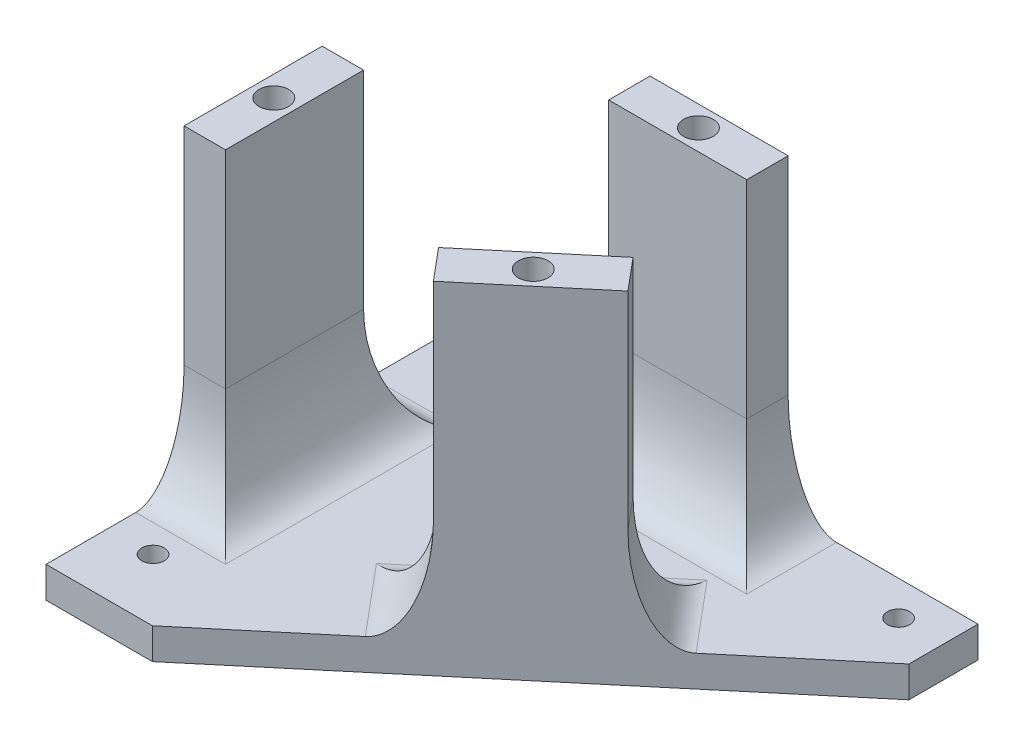
from build123d import *

# Parameters (mm, degrees)
SKETCH1_R           = 1.625
BOSS_EXTRUDE1_DEPTH = 4.5
SKETCH2_W           = 20
SKETCH2_H           = 6
SKETCH2_W_2         = 6
SKETCH2_H_2         = 20
BOSS_EXTRUDE2_DEPTH = 45
SKETCH3_R           = 2.15
CUT_EXTRUDE1_DEPTH  = 5
FILLET1_SIZE        = 7
FILLET1_SIZE_2      = 15


with BuildPart() as part:
    # Sketch1 → Boss-Extrude1 (new body)
    with BuildSketch(Plane(origin=(0, 0, 0), x_dir=(1, 0, 0), z_dir=(0, 1, 0))):
        Polygon((15.41232037, 0), (0, 0), (0, 60), (75, 60), (75, 50), align=None)
        with Locations(Location((68.5, 55, 0), (0, 0, 270))):
            Circle(SKETCH1_R, mode=Mode.SUBTRACT)
        with Locations(Location((6.5, 55, 0), (0, 0, 90))):
            Circle(SKETCH1_R, mode=Mode.SUBTRACT)
        with Locations(Location((6.5, 9, 0), (0, 0, 270))):
            Circle(SKETCH1_R, mode=Mode.SUBTRACT)
    extrude(amount=BOSS_EXTRUDE1_DEPTH)

    # Sketch2 → Boss-Extrude2 (add)
    with BuildSketch(Plane(origin=(0, 4.5, 0), x_dir=(1, 0, 0), z_dir=(0, 1, 0))):
        with Locations((37.5, 57)):
            Rectangle(SKETCH2_W, SKETCH2_H)
        with Locations((3, 30)):
            Rectangle(SKETCH2_W_2, SKETCH2_H_2)
        Polygon((52.866604616, 31.427876097), (37.545715754, 18.572123903), (33.688990096, 23.168390562), (49.009878958, 36.024142756), align=None)
    extrude(amount=BOSS_EXTRUDE2_DEPTH)

    # Sketch3 → Cut-Extrude1 (cut)
    with BuildSketch(Plane(origin=(0, 49.5, 0), x_dir=(1, 0, 0), z_dir=(0, 1, 0))):
        with Locations(Location((3, 30, 0), (0, 0, 270))):
            Circle(SKETCH3_R)
        with Locations(Location((37.5, 57, 0), (0, 0, 270))):
            Circle(SKETCH3_R)
        with Locations(Location((43.277797356, 27.298133329, 0), (0, 0, 270))):
            Circle(SKETCH3_R)
    extrude(amount=-CUT_EXTRUDE1_DEPTH, mode=Mode.SUBTRACT)

    # Fillet1
    # an asymmetric fillet: 15, 7 mm, written as the material it adds along each edge
    with BuildSketch(Plane(origin=(49.009878958, 4.5, -36.024142756), x_dir=(0.7660444431189766, 0, -0.642787609686541), z_dir=(0.6427876096865411, 0, 0.7660444431189767)), Plane(origin=(0, 4.5, -40), x_dir=(0, 0, -1), z_dir=(1, 0, 0)), Plane(origin=(37.545715754, 4.5, -18.572123903), x_dir=(-0.7660444431189747, 0, 0.6427876096865432), z_dir=(-0.6427876096865432, 0, -0.7660444431189748)), Plane(origin=(6, 4.5, -20), x_dir=(0, 0, 1), z_dir=(-1, 0, 0))) as fillet1_piece_1:
        with BuildLine():
            Bezier((FILLET1_SIZE, 0), (0, 0), (0, FILLET1_SIZE_2), weights=[1, 0.707106781, 1])
            Line((0, FILLET1_SIZE_2), (0, 0))
            Line((0, 0), (FILLET1_SIZE, 0))
        make_face()
    extrude(amount=6)
    with BuildSketch(Plane(origin=(27.5, 4.5, -60), x_dir=(-1, 0, 0), z_dir=(0, 0, 1)), Plane(origin=(47.5, 4.5, -54), x_dir=(1, 0, 0), z_dir=(0, 0, -1))) as fillet1_piece_2:
        with BuildLine():
            Bezier((FILLET1_SIZE, 0), (0, 0), (0, -FILLET1_SIZE_2), weights=[1, 0.707106781, 1])
            Line((0, -FILLET1_SIZE_2), (0, 0))
            Line((0, 0), (FILLET1_SIZE, 0))
        make_face()
    extrude(amount=6)
    with BuildSketch(Plane(origin=(33.688990096, 4.5, -23.168390562), x_dir=(-0.6427876096865404, 0, -0.7660444431189772), z_dir=(0.7660444431189771, 0, -0.6427876096865404)), Plane(origin=(6, 4.5, -40), x_dir=(1, 0, 0), z_dir=(0, 0, 1))) as fillet1_piece_3:
        with BuildLine():
            Bezier((FILLET1_SIZE, 0), (0, 0), (0, FILLET1_SIZE_2), weights=[1, 0.707106781, 1])
            Line((0, FILLET1_SIZE_2), (0, 0))
            Line((0, 0), (FILLET1_SIZE, 0))
        make_face()
    extrude(amount=20)
    with BuildSketch(Plane(origin=(27.5, 4.5, -54), x_dir=(0, 0, 1), z_dir=(1, 0, 0))) as fillet1_piece_4:
        with BuildLine():
            Bezier((FILLET1_SIZE, 0), (0, 0), (0, -FILLET1_SIZE_2), weights=[1, 0.707106781, 1])
            Line((0, -FILLET1_SIZE_2), (0, 0))
            Line((0, 0), (FILLET1_SIZE, 0))
        make_face()
    extrude(amount=20)
    with BuildSketch(Plane(origin=(33.688990096, 4.5, -23.168390562), x_dir=(-0.6427876096865404, 0, -0.7660444431189772), z_dir=(0.7660444431189771, 0, -0.6427876096865404))) as fillet1_piece_5a_section:
        with BuildLine():
            Bezier((FILLET1_SIZE, 0), (0, 0), (0, FILLET1_SIZE_2), weights=[1, 0.707106781, 1])
            Line((0, FILLET1_SIZE_2), (0, 0))
            Line((0, 0), (FILLET1_SIZE, 0))
        make_face()
    fillet1_piece_5a = extrude(amount=57.5, mode=Mode.PRIVATE)
    fillet1_piece_5a = split(fillet1_piece_5a, bisect_by=Plane(origin=(75, 8.294639166, -47.759587759), z_dir=(-1, 0, 0)), keep=Keep.TOP, mode=Mode.PRIVATE)
    fillet1_piece_5a = split(fillet1_piece_5a, bisect_by=Plane(origin=(60.829752449, 8.294639166, -60), z_dir=(0, 0, 1)), keep=Keep.TOP, mode=Mode.PRIVATE)
    fillet1_piece_5a = fillet1_piece_5a - Plane(origin=(68.5, 8.294639166, -55), x_dir=(0, 0, 1), z_dir=(0, -1, 0)) * Cylinder(1.625, 175, mode=Mode.PRIVATE)
    fillet1_piece_5a = split(fillet1_piece_5a, bisect_by=Plane(origin=(48.114987345, 8.294639166, -37.09063305), z_dir=(0.7660444431189766, 0, -0.642787609686541)), keep=Keep.TOP, mode=Mode.PRIVATE)
    with BuildSketch(Plane(origin=(24.905343595, 4.5, -64.750809373), x_dir=(0.7660444431189766, 0, -0.6427876096865409), z_dir=(0.6427876096865411, 0, 0.7660444431189767))) as fillet1_piece_5b_section:
        with BuildLine():
            Bezier((FILLET1_SIZE, 0), (0, 0), (0, FILLET1_SIZE_2), weights=[1, 0.707106781, 1])
            Line((0, FILLET1_SIZE_2), (0, 0))
            Line((0, 0), (FILLET1_SIZE, 0))
        make_face()
    fillet1_piece_5b = extrude(amount=43.5, mode=Mode.PRIVATE)
    fillet1_piece_5b = split(fillet1_piece_5b, bisect_by=Plane(origin=(50.108066505, 8.227156202, -36.945631521), z_dir=(-0.6427876096865404, 0, -0.7660444431189771)), keep=Keep.TOP, mode=Mode.PRIVATE)
    fillet1_piece_5 = fillet1_piece_5a & fillet1_piece_5b
    add(fillet1_piece_5)
    with BuildSketch(Plane(origin=(0, 4.5, -40), x_dir=(0, 0, -1), z_dir=(1, 0, 0))) as fillet1_piece_6a_section:
        with BuildLine():
            Bezier((FILLET1_SIZE, 0), (0, 0), (0, FILLET1_SIZE_2), weights=[1, 0.707106781, 1])
            Line((0, FILLET1_SIZE_2), (0, 0))
            Line((0, 0), (FILLET1_SIZE, 0))
        make_face()
    fillet1_piece_6a = extrude(amount=43.5, mode=Mode.PRIVATE)
    fillet1_piece_6a = split(fillet1_piece_6a, bisect_by=Plane(origin=(6, 8.227154746, -41.433583062), z_dir=(1, 0, 0)), keep=Keep.TOP, mode=Mode.PRIVATE)
    with BuildSketch(Plane(origin=(6, 4.5, -77.5), x_dir=(1, 0, 0), z_dir=(0, 0, 1))) as fillet1_piece_6b_section:
        with BuildLine():
            Bezier((FILLET1_SIZE, 0), (0, 0), (0, FILLET1_SIZE_2), weights=[1, 0.707106781, 1])
            Line((0, FILLET1_SIZE_2), (0, 0))
            Line((0, 0), (FILLET1_SIZE, 0))
        make_face()
    fillet1_piece_6b = extrude(amount=57.5, mode=Mode.PRIVATE)
    fillet1_piece_6b = split(fillet1_piece_6b, bisect_by=Plane(origin=(7.535537535, 8.087590717, -60), z_dir=(0, 0, 1)), keep=Keep.TOP, mode=Mode.PRIVATE)
    fillet1_piece_6b = fillet1_piece_6b - Plane(origin=(6.5, 8.087590717, -55), x_dir=(0, 0, -1), z_dir=(0, -1, 0)) * Cylinder(1.625, 175, mode=Mode.PRIVATE)
    fillet1_piece_6b = split(fillet1_piece_6b, bisect_by=Plane(origin=(7.535537535, 8.087590717, -40), z_dir=(0, 0, -1)), keep=Keep.TOP, mode=Mode.PRIVATE)
    fillet1_piece_6 = fillet1_piece_6a & fillet1_piece_6b
    add(fillet1_piece_6)
    with BuildSketch(Plane(origin=(37.545715754, 4.5, -18.572123903), x_dir=(-0.7660444431189747, 0, 0.6427876096865432), z_dir=(-0.6427876096865432, 0, -0.7660444431189748))) as fillet1_piece_7a_section:
        with BuildLine():
            Bezier((FILLET1_SIZE, 0), (0, 0), (0, FILLET1_SIZE_2), weights=[1, 0.707106781, 1])
            Line((0, FILLET1_SIZE_2), (0, 0))
            Line((0, 0), (FILLET1_SIZE, 0))
        make_face()
    fillet1_piece_7a = extrude(amount=43.5, mode=Mode.PRIVATE)
    fillet1_piece_7a = split(fillet1_piece_7a, bisect_by=Plane(origin=(32.590801758, 8.227154758, -22.246901132), z_dir=(-0.6427876096865404, 0, -0.7660444431189771)), keep=Keep.TOP, mode=Mode.PRIVATE)
    with BuildSketch(Plane(origin=(4.962323479, 4.5, 0.936144801), x_dir=(-0.6427876096865404, 0, -0.7660444431189771), z_dir=(0.7660444431189771, 0, -0.6427876096865404))) as fillet1_piece_7b_section:
        with BuildLine():
            Bezier((FILLET1_SIZE, 0), (0, 0), (0, FILLET1_SIZE_2), weights=[1, 0.707106781, 1])
            Line((0, FILLET1_SIZE_2), (0, 0))
            Line((0, 0), (FILLET1_SIZE, 0))
        make_face()
    fillet1_piece_7b = extrude(amount=57.5, mode=Mode.PRIVATE)
    fillet1_piece_7b = split(fillet1_piece_7b, bisect_by=Plane(origin=(18.636133347, 8.197576352, 0), z_dir=(0, 0, -1)), keep=Keep.TOP, mode=Mode.PRIVATE)
    fillet1_piece_7b = fillet1_piece_7b - Plane(origin=(6.5, 8.197576352, -9), x_dir=(0, 0, 1), z_dir=(0, -1, 0)) * Cylinder(1.625, 175, mode=Mode.PRIVATE)
    fillet1_piece_7b = split(fillet1_piece_7b, bisect_by=Plane(origin=(32.760947063, 8.197576352, -24.27438918), z_dir=(-0.7660444431189748, 0, 0.6427876096865432)), keep=Keep.TOP, mode=Mode.PRIVATE)
    fillet1_piece_7 = fillet1_piece_7a & fillet1_piece_7b
    add(fillet1_piece_7)
    with BuildSketch(Plane(origin=(6, 4.5, -40), x_dir=(1, 0, 0), z_dir=(0, 0, 1))) as fillet1_piece_8a_section:
        with BuildLine():
            Bezier((FILLET1_SIZE, 0), (0, 0), (0, FILLET1_SIZE_2), weights=[1, 0.707106781, 1])
            Line((0, FILLET1_SIZE_2), (0, 0))
            Line((0, 0), (FILLET1_SIZE, 0))
        make_face()
    fillet1_piece_8a = extrude(amount=57.5, mode=Mode.PRIVATE)
    fillet1_piece_8a = split(fillet1_piece_8a, bisect_by=Plane(origin=(7.977246716, 8.859328902, 0), z_dir=(0, 0, -1)), keep=Keep.TOP, mode=Mode.PRIVATE)
    fillet1_piece_8a = fillet1_piece_8a - Plane(origin=(6.5, 8.859328902, -9), x_dir=(0, 0, 1), z_dir=(0, -1, 0)) * Cylinder(1.625, 175, mode=Mode.PRIVATE)
    fillet1_piece_8a = split(fillet1_piece_8a, bisect_by=Plane(origin=(7.977246716, 8.859328902, -20), z_dir=(0, 0, 1)), keep=Keep.TOP, mode=Mode.PRIVATE)
    with BuildSketch(Plane(origin=(43.5, 4.5, -20), x_dir=(0, 0, 1), z_dir=(-1, 0, 0))) as fillet1_piece_8b_section:
        with BuildLine():
            Bezier((FILLET1_SIZE, 0), (0, 0), (0, FILLET1_SIZE_2), weights=[1, 0.707106781, 1])
            Line((0, FILLET1_SIZE_2), (0, 0))
            Line((0, 0), (FILLET1_SIZE, 0))
        make_face()
    fillet1_piece_8b = extrude(amount=43.5, mode=Mode.PRIVATE)
    fillet1_piece_8b = split(fillet1_piece_8b, bisect_by=Plane(origin=(28.359375086, 8.347664515, -10.863868837), z_dir=(-0.6427876096865403, 0, -0.7660444431189773)), keep=Keep.TOP, mode=Mode.PRIVATE)
    fillet1_piece_8b = split(fillet1_piece_8b, bisect_by=Plane(origin=(6, 8.347664515, -18.654716418), z_dir=(1, 0, 0)), keep=Keep.TOP, mode=Mode.PRIVATE)
    fillet1_piece_8 = fillet1_piece_8a & fillet1_piece_8b
    add(fillet1_piece_8)
    with BuildSketch(Plane(origin=(-10, 4.5, -54), x_dir=(0, 0, 1), z_dir=(1, 0, 0))) as fillet1_piece_9a_section:
        with BuildLine():
            Bezier((FILLET1_SIZE, 0), (0, 0), (0, -FILLET1_SIZE_2), weights=[1, 0.707106781, 1])
            Line((0, -FILLET1_SIZE_2), (0, 0))
            Line((0, 0), (FILLET1_SIZE, 0))
        make_face()
    fillet1_piece_9a = extrude(amount=57.5, mode=Mode.PRIVATE)
    fillet1_piece_9a = split(fillet1_piece_9a, bisect_by=Plane(origin=(0, 8.13747617, -52.520587064), z_dir=(1, 0, 0)), keep=Keep.TOP, mode=Mode.PRIVATE)
    fillet1_piece_9a = fillet1_piece_9a - Plane(origin=(6.5, 8.13747617, -55), x_dir=(0, 0, -1), z_dir=(0, -1, 0)) * Cylinder(1.625, 175, mode=Mode.PRIVATE)
    fillet1_piece_9a = split(fillet1_piece_9a, bisect_by=Plane(origin=(27.5, 8.13747617, -52.520587064), z_dir=(-1, 0, 0)), keep=Keep.TOP, mode=Mode.PRIVATE)
    with BuildSketch(Plane(origin=(27.5, 4.5, -60), x_dir=(-1, 0, 0), z_dir=(0, 0, 1))) as fillet1_piece_9b_section:
        with BuildLine():
            Bezier((FILLET1_SIZE, 0), (0, 0), (0, -FILLET1_SIZE_2), weights=[1, 0.707106781, 1])
            Line((0, -FILLET1_SIZE_2), (0, 0))
            Line((0, 0), (FILLET1_SIZE, 0))
        make_face()
    fillet1_piece_9b = extrude(amount=43.5, mode=Mode.PRIVATE)
    fillet1_piece_9b = split(fillet1_piece_9b, bisect_by=Plane(origin=(26.066416938, 8.227154746, -54), z_dir=(0, 0, 1)), keep=Keep.TOP, mode=Mode.PRIVATE)
    fillet1_piece_9 = fillet1_piece_9a & fillet1_piece_9b
    add(fillet1_piece_9)
    with BuildSketch(Plane(origin=(47.5, 4.5, -16.5), x_dir=(1, 0, 0), z_dir=(0, 0, -1))) as fillet1_piece_10a_section:
        with BuildLine():
            Bezier((FILLET1_SIZE, 0), (0, 0), (0, -FILLET1_SIZE_2), weights=[1, 0.707106781, 1])
            Line((0, -FILLET1_SIZE_2), (0, 0))
            Line((0, 0), (FILLET1_SIZE, 0))
        make_face()
    fillet1_piece_10a = extrude(amount=43.5, mode=Mode.PRIVATE)
    fillet1_piece_10a = split(fillet1_piece_10a, bisect_by=Plane(origin=(55.243266099, 8.330588612, -33.422131871), z_dir=(-0.6427876096865403, 0, -0.7660444431189773)), keep=Keep.TOP, mode=Mode.PRIVATE)
    fillet1_piece_10a = split(fillet1_piece_10a, bisect_by=Plane(origin=(48.857795406, 8.330588612, -54), z_dir=(0, 0, 1)), keep=Keep.TOP, mode=Mode.PRIVATE)
    with BuildSketch(Plane(origin=(27.5, 4.5, -54), x_dir=(0, 0, 1), z_dir=(1, 0, 0))) as fillet1_piece_10b_section:
        with BuildLine():
            Bezier((FILLET1_SIZE, 0), (0, 0), (0, -FILLET1_SIZE_2), weights=[1, 0.707106781, 1])
            Line((0, -FILLET1_SIZE_2), (0, 0))
            Line((0, 0), (FILLET1_SIZE, 0))
        make_face()
    fillet1_piece_10b = extrude(amount=57.5, mode=Mode.PRIVATE)
    fillet1_piece_10b = split(fillet1_piece_10b, bisect_by=Plane(origin=(68.011756194, 8.150775734, -44.1361672), z_dir=(-0.6427876096865403, 0, -0.7660444431189773)), keep=Keep.TOP, mode=Mode.PRIVATE)
    fillet1_piece_10b = split(fillet1_piece_10b, bisect_by=Plane(origin=(75, 8.150775734, -52.5360496), z_dir=(-1, 0, 0)), keep=Keep.TOP, mode=Mode.PRIVATE)
    fillet1_piece_10b = fillet1_piece_10b - Plane(origin=(68.5, 8.150775734, -55), x_dir=(0, 0, 1), z_dir=(0, -1, 0)) * Cylinder(1.625, 175, mode=Mode.PRIVATE)
    fillet1_piece_10b = split(fillet1_piece_10b, bisect_by=Plane(origin=(47.5, 8.150775734, -52.5360496), z_dir=(1, 0, 0)), keep=Keep.TOP, mode=Mode.PRIVATE)
    fillet1_piece_10 = fillet1_piece_10a & fillet1_piece_10b
    add(fillet1_piece_10)


solid = part.part
